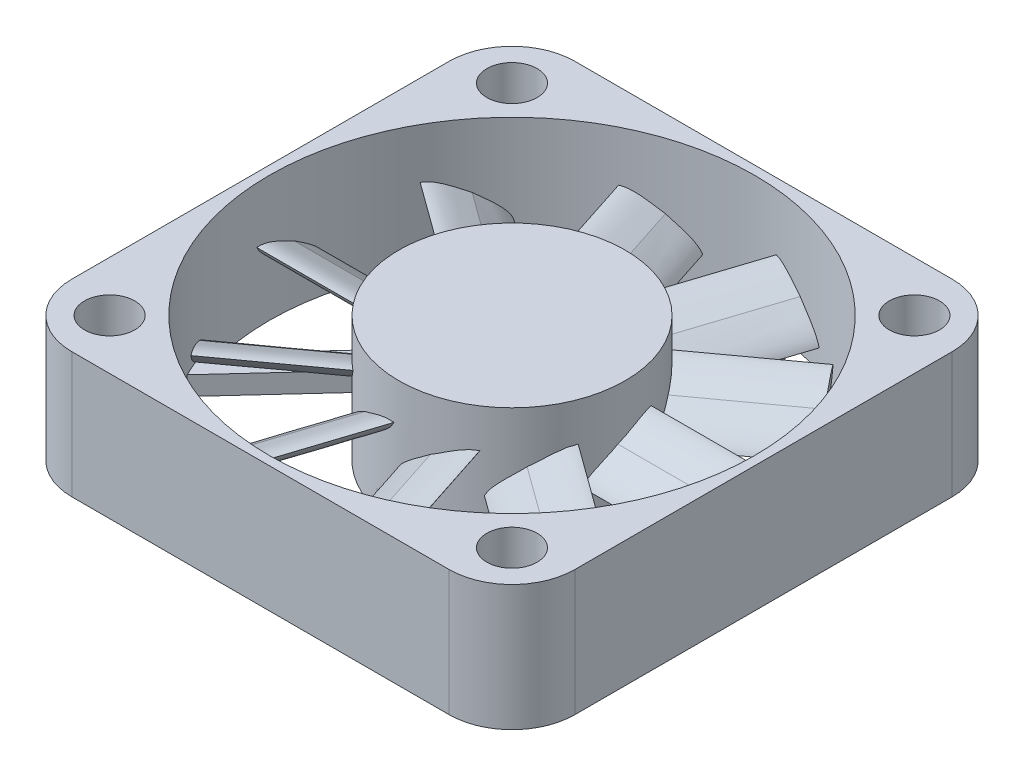
from build123d import *
from build123d.topology import SkipClean

# Parameters (mm, degrees)
SKETCH1_W           = 40
SKETCH1_H           = 40
BOSS_EXTRUDE1_DEPTH = 10
SKETCH2_R           = 19.3
CUT_EXTRUDE1_DEPTH  = 10
BOSS_EXTRUDE2_START = -1.5
BOSS_EXTRUDE2_DEPTH = 1.5
BOSS_EXTRUDE3_START = 8.5
SKETCH4_R           = 9
BOSS_EXTRUDE3_DEPTH = 8.5
BOSS_EXTRUDE4_START = -1
BOSS_EXTRUDE4_DEPTH = 9.9
CIRPATTERN2_COUNT   = 10
FILLET1_R           = 5
SKETCH8_R           = 2
CUT_EXTRUDE2_DEPTH  = 10


with BuildPart() as part:
    # Sketch1 → Boss-Extrude1 (new body)
    with BuildSketch(Plane(origin=(0, 0, 0), x_dir=(1, 0, 0), z_dir=(0, 1, 0))):
        with Locations((20, 20)):
            Rectangle(SKETCH1_W, SKETCH1_H)
    extrude(amount=BOSS_EXTRUDE1_DEPTH)

    # Sketch2 → Cut-Extrude1 (cut)
    with BuildSketch(Plane(origin=(0, 10, 0), x_dir=(1, 0, 0), z_dir=(0, 1, 0))):
        with Locations((20, 20)):
            Circle(SKETCH2_R)
    extrude(amount=-CUT_EXTRUDE1_DEPTH, mode=Mode.SUBTRACT)

    # Sketch3 → Boss-Extrude2 (add)
    with BuildSketch(Plane.XZ.offset(BOSS_EXTRUDE2_START)):
        with BuildLine():
            Line((34.699624143, -7.493559656), (18.037420191, -11.216590611))
            ThreePointArc((18.037420191, -11.216590611), (12.800560845, -14.599252287), (11.018285345, -20.573412468))
            Line((11.018285345, -20.573412468), (2.673832422, -11.497417036))
            ThreePointArc((2.673832422, -11.497417036), (2.217698232, -12.49801734), (1.81929288, -13.522972238))
            Line((1.81929288, -13.522972238), (13.374634242, -26.091348666))
            ThreePointArc((13.374634242, -26.091348666), (18.922534859, -28.935271057), (24.987447092, -27.491686826))
            Line((24.987447092, -27.491686826), (21.299630944, -39.256192755))
            ThreePointArc((21.299630944, -39.256192755), (22.394243322, -39.150916399), (23.481082977, -38.983468105))
            Line((23.481082977, -38.983468105), (28.587945567, -22.692060723))
            ThreePointArc((28.587945567, -22.692060723), (28.276904296, -16.465476655), (23.994267563, -11.934900705))
            Line((23.994267563, -11.934900705), (36.026536634, -9.24639021))
            ThreePointArc((36.026536634, -9.24639021), (35.388058446, -8.351066261), (34.699624143, -7.493559656))
        make_face()
    extrude(amount=BOSS_EXTRUDE2_DEPTH)

    # Sketch4 → Boss-Extrude3 (add)
    with BuildSketch(Plane(origin=(0, 1.5, 0), x_dir=(1, 0, 0), z_dir=(0, 1, 0)).offset(BOSS_EXTRUDE3_START)):
        with Locations((20, 20)):
            Circle(SKETCH4_R)
    extrude(amount=-BOSS_EXTRUDE3_DEPTH)

    # Fillet1
    fillet1_edges = [part.edges().sort_by_distance(p)[0] for p in [
        (0, 5, 0),
        (0, 5, -40),
        (40, 5, -40),
        (40, 5, 0),
    ]]
    fillet(fillet1_edges, radius=FILLET1_R)

    # Sketch8 → Cut-Extrude2 (cut)
    with SkipClean():  # the faces are left unmerged after this step: merging them gives an invalid solid
        with BuildSketch(Plane(origin=(0, 10, 0), x_dir=(1, 0, 0), z_dir=(0, 1, 0))):
            with Locations((36, 36)):
                Circle(SKETCH8_R)
            with Locations((4, 36)):
                Circle(SKETCH8_R)
            with Locations((36, 4)):
                Circle(SKETCH8_R)
            with Locations((4, 4)):
                Circle(SKETCH8_R)
        extrude(amount=-CUT_EXTRUDE2_DEPTH, mode=Mode.SUBTRACT)


with BuildPart() as body_2:
    # Sketch6 → Boss-Extrude4 (new body)
    with BuildSketch(Plane(origin=(29, 10, -20), x_dir=(0, 0, -1), z_dir=(1, 0, 0)).offset(BOSS_EXTRUDE4_START)):
        with BuildLine():
            add(Edge.make_bspline(
                [(-0.564072482, -4.090856608), (-0.0422183, -3.839345614), (0.877288114, -3.33857128), (1.915283285, -3.03394168), (2.39418842, -3.076819893)],
                knots=[0, 0, 0, 0, 0.54810866, 1, 1, 1, 1], degree=3))
            add(Edge.make_bspline(
                [(0.036876414, -5.131730629), (0.515618415, -4.805547147), (1.409054917, -4.2596184), (2.191869475, -3.513003013), (2.39418842, -3.076819893)],
                knots=[0, 0, 0, 0, 0.54810866, 1, 1, 1, 1], degree=3))
            add(Edge.make_bspline(
                [(0.036876414, -5.131730629), (-0.484977769, -5.383241623), (-1.404484183, -5.884015956), (-2.442479354, -6.188645557), (-2.921384489, -6.145767343)],
                knots=[0, 0, 0, 0, 0.54810866, 1, 1, 1, 1], degree=3))
            add(Edge.make_bspline(
                [(-0.564072482, -4.090856608), (-1.042814484, -4.41704009), (-1.936250985, -4.962968837), (-2.719065544, -5.709584224), (-2.921384489, -6.145767343)],
                knots=[0, 0, 0, 0, 0.54810866, 1, 1, 1, 1], degree=3))
        make_face()
    extrude(amount=BOSS_EXTRUDE4_DEPTH)


with BuildPart() as cirpattern2_1:
    # CirPattern2: pattern copy
    add(body_2.part.rotate(Axis((20, 10, -20), (0, -1, 0)), 1 * 360 / CIRPATTERN2_COUNT))


with BuildPart() as cirpattern2_2:
    # CirPattern2: pattern copy
    add(body_2.part.rotate(Axis((20, 10, -20), (0, -1, 0)), 2 * 360 / CIRPATTERN2_COUNT))


with BuildPart() as cirpattern2_3:
    # CirPattern2: pattern copy
    add(body_2.part.rotate(Axis((20, 10, -20), (0, -1, 0)), 3 * 360 / CIRPATTERN2_COUNT))


with BuildPart() as cirpattern2_4:
    # CirPattern2: pattern copy
    add(body_2.part.rotate(Axis((20, 10, -20), (0, -1, 0)), 4 * 360 / CIRPATTERN2_COUNT))


with BuildPart() as cirpattern2_5:
    # CirPattern2: pattern copy
    add(body_2.part.rotate(Axis((20, 10, -20), (0, -1, 0)), 5 * 360 / CIRPATTERN2_COUNT))


with BuildPart() as cirpattern2_6:
    # CirPattern2: pattern copy
    add(body_2.part.rotate(Axis((20, 10, -20), (0, -1, 0)), 6 * 360 / CIRPATTERN2_COUNT))


with BuildPart() as cirpattern2_7:
    # CirPattern2: pattern copy
    add(body_2.part.rotate(Axis((20, 10, -20), (0, -1, 0)), 7 * 360 / CIRPATTERN2_COUNT))


with BuildPart() as cirpattern2_8:
    # CirPattern2: pattern copy
    add(body_2.part.rotate(Axis((20, 10, -20), (0, -1, 0)), 8 * 360 / CIRPATTERN2_COUNT))


with BuildPart() as cirpattern2_9:
    # CirPattern2: pattern copy
    add(body_2.part.rotate(Axis((20, 10, -20), (0, -1, 0)), 9 * 360 / CIRPATTERN2_COUNT))


solid = Compound([part.part, body_2.part, cirpattern2_1.part, cirpattern2_2.part, cirpattern2_3.part, cirpattern2_4.part, cirpattern2_5.part, cirpattern2_6.part, cirpattern2_7.part, cirpattern2_8.part, cirpattern2_9.part])
